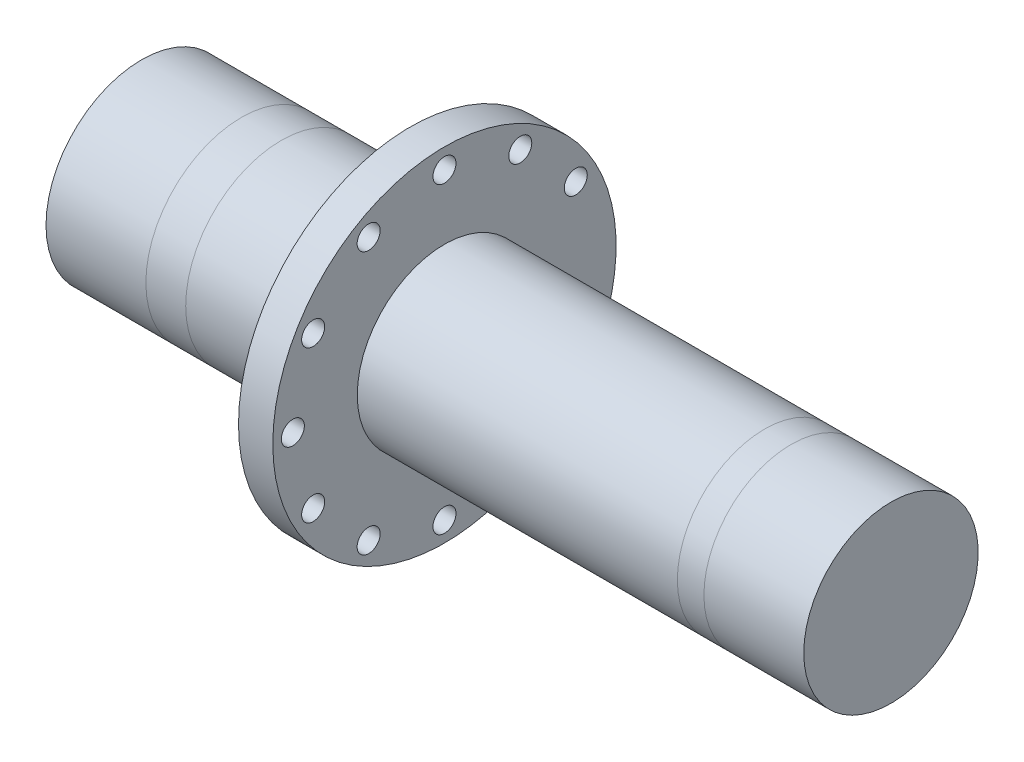
from build123d import *

# Parameters (mm, degrees)
M6_CLEARANCE_HOLE1_D = 6.6


with BuildPart() as part:
    # Sketch1 → Revolve1 (revolve)
    with BuildSketch(Plane(origin=(0, 0, 0), x_dir=(1, 0, 0), z_dir=(0, 1, 0))):
        Polygon((0, 27.432), (0, 0), (76.962, 0), (148.082, 0), (215, 0), (215, 25.019), (148.198, 25.019), (86.8925, 25.019), (86.8925, 49.25), (77.05, 49.25), (77.05, 27.432), align=None)
    revolve(axis=Axis((0, 0, 0), (1, 0, 0)))

    # M6 Clearance Hole1 (through all)
    with Locations(Plane(origin=(77.05, -169.812843678, -45.135624771), x_dir=(0, 0.9984760347247558, 0.055187028188952415), z_dir=(-1, 0, 0))):
        with Locations((191.682798084, 3.119638601), (208.459332121, -11.89950811), (215.47866343, -33.294737723), (210.859967854, -55.333215742), (195.840821144, -72.109749779), (174.445591531, -79.129081088), (152.407113512, -74.510385512), (135.630579474, -59.491238802), (128.611248165, -38.096009189), (133.229943741, -16.057531169), (148.249090452, 0.719002868)):
            Hole(M6_CLEARANCE_HOLE1_D / 2)


solid = part.part
